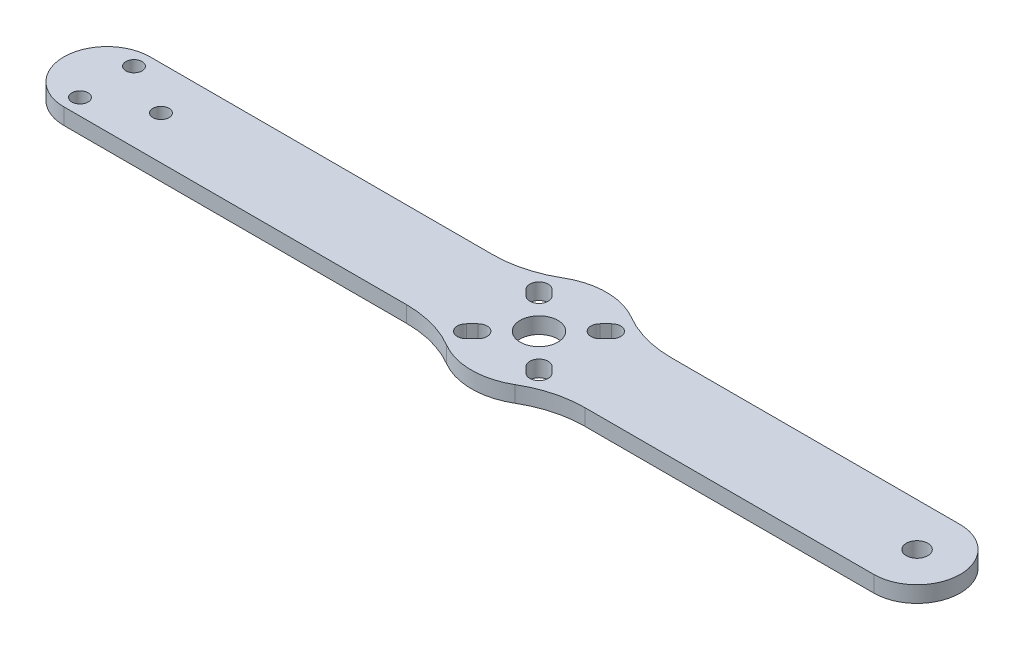
from build123d import *

# Parameters (mm, degrees)
EXTRUDE_1_DEPTH     = 3
SKETCH_8_R          = 12.5
EXTRUDE_2_DEPTH     = 3
SKETCH_2_R          = 3.5
CUT_EXTRUDE_1_DEPTH = 159.522080481
SKETCH_5_R          = 1.5
CUT_EXTRUDE_2_DEPTH = 159.522080481
FILLET_3_R          = 20
SKETCH_9_R          = 2
CUT_EXTRUDE_3_DEPTH = 159.522080481


with BuildPart() as part:
    # 草图1 → 凸台-拉伸1 (new body)
    with BuildSketch(Plane(origin=(0, 0, 0), x_dir=(1, 0, 0), z_dir=(0, 1, 0))):
        with BuildLine():
            Line((0, 8), (150, 8))
            ThreePointArc((150, 8), (158, 0), (150, -8))
            Line((150, -8), (0, -8))
            ThreePointArc((0, -8), (-8, 0), (0, 8))
        make_face()
    extrude(amount=EXTRUDE_1_DEPTH)

    # 草图8 → 凸台-拉伸2 (add)
    with BuildSketch(Plane(origin=(0, 3, 0), x_dir=(1, 0, 0), z_dir=(0, 1, 0))):
        with Locations((80, 0)):
            Circle(SKETCH_8_R)
    extrude(amount=-EXTRUDE_2_DEPTH)

    # 草图2 → 切除-拉伸1 (cut, through all)
    with BuildSketch(Plane(origin=(0, 3, 0), x_dir=(1, 0, 0), z_dir=(0, 1, 0))):
        with Locations((80, 0)):
            Circle(SKETCH_2_R)
        with BuildLine():
            Line((84.456249475, 6.857459024), (85.516909647, 7.918119195))
            ThreePointArc((85.516909647, 7.918119195), (87.918119195, 7.918119195), (87.918119195, 5.516909647))
            Line((87.918119195, 5.516909647), (86.857459024, 4.456249475))
            ThreePointArc((86.857459024, 4.456249475), (84.456249475, 4.456249475), (84.456249475, 6.857459024))
        make_face()
        with BuildLine():
            Line((84.456249475, -6.857459024), (85.516909647, -7.918119195))
            ThreePointArc((85.516909647, -7.918119195), (87.918119195, -7.918119195), (87.918119195, -5.516909647))
            Line((87.918119195, -5.516909647), (86.857459024, -4.456249475))
            ThreePointArc((86.857459024, -4.456249475), (84.456249475, -4.456249475), (84.456249475, -6.857459024))
        make_face()
        with BuildLine():
            Line((73.142540976, -4.456249475), (72.081880805, -5.516909647))
            ThreePointArc((72.081880805, -5.516909647), (72.081880805, -7.918119195), (74.483090353, -7.918119195))
            Line((74.483090353, -7.918119195), (75.543750525, -6.857459024))
            ThreePointArc((75.543750525, -6.857459024), (75.543750525, -4.456249475), (73.142540976, -4.456249475))
        make_face()
        with BuildLine():
            Line((75.543750525, 6.857459024), (74.483090353, 7.918119195))
            ThreePointArc((74.483090353, 7.918119195), (72.081880805, 7.918119195), (72.081880805, 5.516909647))
            Line((72.081880805, 5.516909647), (73.142540976, 4.456249475))
            ThreePointArc((73.142540976, 4.456249475), (75.543750525, 4.456249475), (75.543750525, 6.857459024))
        make_face()
    extrude(amount=-CUT_EXTRUDE_1_DEPTH, mode=Mode.SUBTRACT)

    # 草图5 → 切除-拉伸2 (cut, through all)
    with BuildSketch(Plane(origin=(0, 3, 0), x_dir=(1, 0, 0), z_dir=(0, 1, 0))):
        with Locations((10, 0)):
            Circle(SKETCH_5_R)
        with Locations((0, 5)):
            Circle(SKETCH_5_R)
        with Locations((0, -5)):
            Circle(SKETCH_5_R)
    extrude(amount=-CUT_EXTRUDE_2_DEPTH, mode=Mode.SUBTRACT)

    # 圆角3
    fillet_3_edges = [part.edges().sort_by_distance(p)[0] for p in [
        (70.395313644, 1.5, 8),
        (89.604686356, 1.5, 8),
        (89.604686356, 1.5, -8),
        (70.395313644, 1.5, -8),
    ]]
    fillet(fillet_3_edges, radius=FILLET_3_R)

    # 草图9 → 切除-拉伸3 (cut, through all)
    with BuildSketch(Plane(origin=(0, 3, 0), x_dir=(1, 0, 0), z_dir=(0, 1, 0))):
        with Locations((150, 0)):
            Circle(SKETCH_9_R)
    extrude(amount=-CUT_EXTRUDE_3_DEPTH, mode=Mode.SUBTRACT)


solid = part.part
